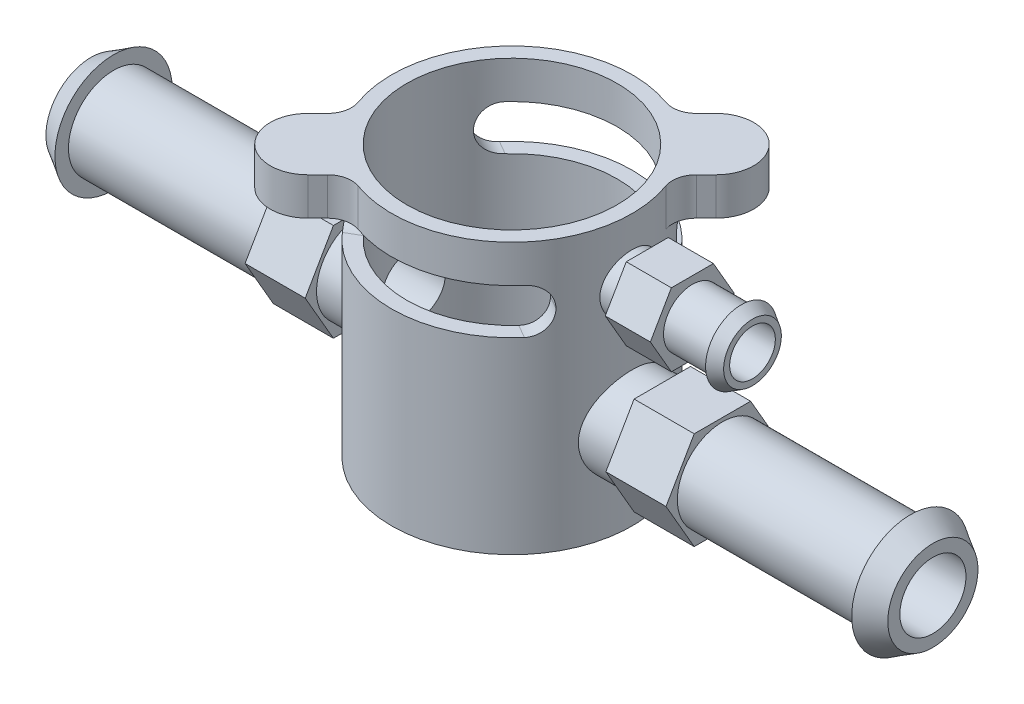
from build123d import *

# Parameters (mm, degrees)
SKETCH1_R               = 25.4
BOSS_EXTRUDE1_DEPTH     = 57.15
SKETCH2_R               = 9.525
BOSS_EXTRUDE2_DEPTH     = 88.9
SKETCH2_3_R             = 6.096
BOSS_EXTRUDE3_DEPTH     = 50.8
BOSS_EXTRUDE5_START     = 31.75
BOSS_EXTRUDE5_DEPTH     = 12.7
BOSS_EXTRUDE6_START     = 28.575
BOSS_EXTRUDE6_DEPTH     = 9.525
SKETCH8_R               = 22.225
CUT_EXTRUDE2_DEPTH      = 53.975
CUT_EXTRUDE1_DEPTH      = 4.7625
FILLET2_R               = 4.7625
BOSS_EXTRUDE4_START     = -7.9375
BOSS_EXTRUDE4_DEPTH     = 7.9375
FILLET1_R               = 5.08
FILLET1_OF_MIRROR1_R    = 5.08
CUT_EXTRUDE3_DEPTH      = 110.72237409
CUT_EXTRUDE3_DEPTH_BACK = 110.72237409
SKETCH2_10_R            = 6.985
SKETCH2_12_R            = 4.826
CUT_EXTRUDE5_DEPTH      = 110.722374171


with BuildPart() as part:
    # Sketch1 → Boss-Extrude1 (new body)
    with BuildSketch(Plane(origin=(0, 0, 0), x_dir=(1, 0, 0), z_dir=(0, 1, 0))):
        with Locations(Location((0, 0, 0), (0, 0, 270))):
            Circle(SKETCH1_R)
    extrude(amount=BOSS_EXTRUDE1_DEPTH)

    # Sketch2 → Boss-Extrude2 (add)
    with BuildSketch(Plane(origin=(0, 0, 0), x_dir=(0, 0, -1), z_dir=(1, 0, 0))):
        with Locations(Location((0, 19.05, 0), (0, 0, 180))):
            Circle(SKETCH2_R)
    boss_extrude2 = extrude(amount=BOSS_EXTRUDE2_DEPTH)

    # Sketch2<3> → Boss-Extrude3 (add)
    with BuildSketch(Plane(origin=(0, 0, 0), x_dir=(0, 0, -1), z_dir=(1, 0, 0))):
        with Locations(Location((0, 44.45, 0), (0, 0, 180))):
            Circle(SKETCH2_3_R)
    extrude(amount=BOSS_EXTRUDE3_DEPTH)

    # Sketch3 → Revolve1 (revolve)
    with BuildSketch(Plane.XY, mode=Mode.PRIVATE) as revolve1_sk:
        Polygon((88.9, 28.575), (84.1375, 31.4325), (84.1375, 28.575), align=None)
    revolve1 = revolve(revolve1_sk.sketch.rotate(Axis((88.9, 19.05, 0), (-1, 0, 0)), 270), axis=Axis((88.9, 19.05, 0), (-1, 0, 0)))

    # Sketch4 → Revolve2 (revolve)
    with BuildSketch(Plane.XY, mode=Mode.PRIVATE) as revolve2_sk:
        Polygon((50.8, 50.546), (48.41875, 50.546), (48.41875, 51.97475), align=None)
    revolve(revolve2_sk.sketch.rotate(Axis((50.8, 44.45, 0), (-1, 0, 0)), 270), axis=Axis((50.8, 44.45, 0), (-1, 0, 0)))

    # Sketch2<13> → Boss-Extrude5 (add)
    with BuildSketch(Plane(origin=(0, 0, 0), x_dir=(0, 0, -1), z_dir=(1, 0, 0)).offset(BOSS_EXTRUDE5_START)):
        Polygon((-5.95753309, 29.36875), (-11.91506618, 19.05), (-5.95753309, 8.73125), (5.95753309, 8.73125), (11.91506618, 19.05), (5.95753309, 29.36875), align=None)
    boss_extrude5 = extrude(amount=BOSS_EXTRUDE5_DEPTH)

    # Sketch2<14> → Boss-Extrude6 (add)
    with BuildSketch(Plane(origin=(0, 0, 0), x_dir=(0, 0, -1), z_dir=(1, 0, 0)).offset(BOSS_EXTRUDE6_START)):
        Polygon((4.436070793, 52.1335), (-4.436070793, 52.1335), (-8.872141587, 44.45), (-4.436070793, 36.7665), (4.436070793, 36.7665), (8.872141587, 44.45), align=None)
    extrude(amount=BOSS_EXTRUDE6_DEPTH)

    # Mirror2: Boss-Extrude2, Revolve1, Boss-Extrude5 across plane
    add(boss_extrude2.mirror(Plane(origin=(0, 0, 0), x_dir=(0, 0, 1), z_dir=(1, 0, 0))))
    add(revolve1.mirror(Plane(origin=(0, 0, 0), x_dir=(0, 0, 1), z_dir=(1, 0, 0))))
    add(boss_extrude5.mirror(Plane(origin=(0, 0, 0), x_dir=(0, 0, 1), z_dir=(1, 0, 0))))

    # Sketch8 → Cut-Extrude2 (cut)
    with BuildSketch(Plane(origin=(0, 57.15, 0), x_dir=(1, 0, 0), z_dir=(0, 1, 0))):
        with Locations(Location((0, 0, 0), (0, 0, 270))):
            Circle(SKETCH8_R)
    extrude(amount=-CUT_EXTRUDE2_DEPTH, mode=Mode.SUBTRACT)

    # Sketch7 → Cut-Extrude1 (cut, symmetric)
    with BuildSketch(Plane(origin=(0, 44.45, 0), x_dir=(1, 0, 0), z_dir=(0, 1, 0))):
        with BuildLine():
            Line((19.247414599, 11.1125), (21.997045256, 12.7))
            ThreePointArc((21.997045256, 12.7), (0, 25.4), (-21.997045256, 12.7))
            Line((-21.997045256, 12.7), (-19.247414599, 11.1125))
            ThreePointArc((-19.247414599, 11.1125), (0, 22.225), (19.247414599, 11.1125))
        make_face()
        with BuildLine():
            Line((19.247414599, -11.1125), (21.997045256, -12.7))
            ThreePointArc((21.997045256, -12.7), (0, -25.4), (-21.997045256, -12.7))
            Line((-21.997045256, -12.7), (-19.247414599, -11.1125))
            ThreePointArc((-19.247414599, -11.1125), (0, -22.225), (19.247414599, -11.1125))
        make_face()
    extrude(amount=CUT_EXTRUDE1_DEPTH, both=True, mode=Mode.SUBTRACT)

    # Fillet2
    fillet2_edges = [part.edges().sort_by_distance(p)[0] for p in [
        (20.622229928, 49.2125, -11.90625),
        (20.622229928, 39.6875, -11.90625),
        (-20.622229928, 49.2125, -11.90625),
        (-20.622229928, 39.6875, -11.90625),
        (-20.622229928, 49.2125, 11.90625),
        (-20.622229928, 39.6875, 11.90625),
        (20.622229928, 49.2125, 11.90625),
        (20.622229928, 39.6875, 11.90625),
    ]]
    fillet(fillet2_edges, radius=FILLET2_R - 0.0001)  # a hair under: the kernel refuses the full size

    # Sketch5 → Boss-Extrude4 (add)
    with BuildSketch(Plane(origin=(0, 57.15, 0), x_dir=(1, 0, 0), z_dir=(0, 1, 0)).offset(BOSS_EXTRUDE4_START)):
        with BuildLine():
            Line((11.448349475, 22.673669626), (15.939954615, 27.165274766))
            ThreePointArc((15.939954615, 27.165274766), (27.165274766, 27.165274766), (27.165274766, 15.939954615))
            Line((27.165274766, 15.939954615), (22.673669626, 11.448349475))
            ThreePointArc((22.673669626, 11.448349475), (17.960512242, 17.960512242), (11.448349475, 22.673669626))
        make_face()
    boss_extrude4 = extrude(amount=BOSS_EXTRUDE4_DEPTH)

    # Fillet1
    fillet1_edges = [part.edges().sort_by_distance(p)[0] for p in [
        (22.673669626, 53.18125, -11.448349475),
        (11.448349475, 53.18125, -22.673669626),
    ]]
    fillet(fillet1_edges, radius=FILLET1_R)

    # Mirror1: Boss-Extrude4 across plane
    add(boss_extrude4.mirror(Plane(origin=(0, 0, 0), x_dir=(0.7071067811865478, 0, 0.7071067811865472), z_dir=(-0.7071067811865475, 0, 0.7071067811865477))))

    # Fillet1 of Mirror1
    fillet1_of_mirror1_edges = [part.edges().sort_by_distance(p)[0] for p in [
        (-11.448349475, 53.18125, 22.673669626),
        (-22.673669626, 53.18125, 11.448349475),
    ]]
    fillet(fillet1_of_mirror1_edges, radius=FILLET1_OF_MIRROR1_R)

    # Sketch2<10> → Cut-Extrude3 (cut, two sides: drawn at the far end of the back side and taken through both)
    with BuildSketch(Plane(origin=(0, 0, 0), x_dir=(0, 0, -1), z_dir=(1, 0, 0)).offset(-CUT_EXTRUDE3_DEPTH_BACK)):
        with Locations((0, 19.05)):
            Circle(SKETCH2_10_R)
    extrude(amount=CUT_EXTRUDE3_DEPTH + CUT_EXTRUDE3_DEPTH_BACK, mode=Mode.SUBTRACT)

    # Sketch2<12> → Cut-Extrude5 (cut, through all)
    with BuildSketch(Plane(origin=(0, 0, 0), x_dir=(0, 0, -1), z_dir=(1, 0, 0))):
        with Locations(Location((0, 44.45, 0), (0, 0, 180))):
            Circle(SKETCH2_12_R)
    extrude(amount=CUT_EXTRUDE5_DEPTH, mode=Mode.SUBTRACT)


solid = part.part
